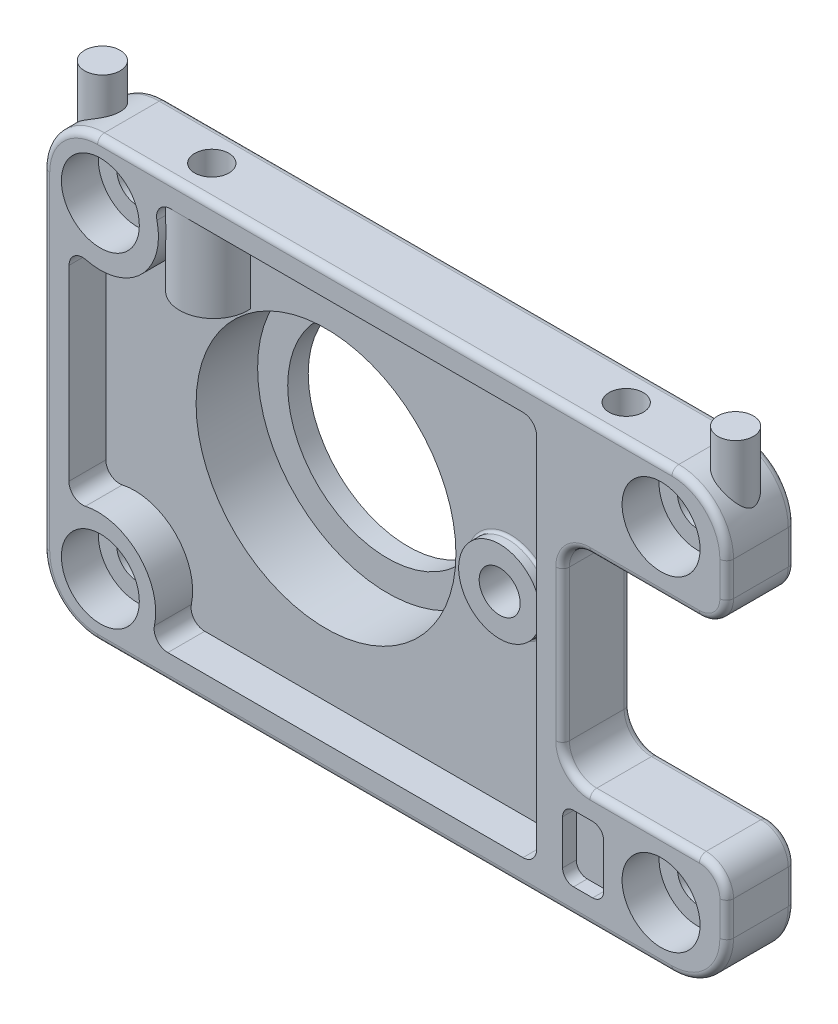
from build123d import *
from build123d.topology import SkipClean

# Parameters (mm, degrees)
SKETCH_1_R             = 1.5
SKETCH_1_R_2           = 9.5
EXTRUDE_1_DEPTH        = 5
CUT_EXTRUDE_START      = -2.7
SKETCH_2_R             = 9.5
SKETCH_2_R_2           = 2.85
SKETCH_2_R_3           = 1.5
CUT_EXTRUDE_1_DEPTH    = 2.7
FILLET_1_R             = 1
FILLET_2_R             = 4
FILLET_3_R             = 2
EXTRUDE_START          = 2.2
SKETCH_3_R             = 11.75
SKETCH_3_R_2           = 9.5
EXTRUDE_2_DEPTH        = 2.2
EXTRUDE_START_2        = 1.5
SKETCH_4_R             = 11.75
SKETCH_4_R_2           = 7.3
EXTRUDE_3_DEPTH        = 1.5
FILLET_4_R             = 0.5
FILLET_5_R             = 0.5
EXTRUDE_7_DEPTH        = 8
HOLE_WIZARD_M3_3_D     = 2.5
HOLE_WIZARD_M3_3_DEPTH = 5.5
HOLE_WIZARD_M3_3_TIP   = 0.751075774
FILLET_6_R             = 0.5
EXTRUDE_8_REACH        = 62.953
EXTRUDE_8_END_RADIUS   = 4
SKETCH_14_R            = 1.3
SKETCH_15_3_W          = 3
SKETCH_15_3_H          = 4.84
CUT_EXTRUDE_5_DEPTH    = 1
FILLET_9_R             = 0.8
SKETCH_16_R            = 3
SKETCH_16_R_2          = 1.5
EXTRUDE_9_DEPTH        = 0.8
EXTRUDE_START_3        = -4
SKETCH_16_2_R          = 3
EXTRUDE_10_DEPTH       = 4
CUT_EXTRUDE_START_2    = -3.6
CUT_EXTRUDE_3_DEPTH    = 3.6
FILLET_8_R             = 0.2
SKETCH_17_R            = 2.85
SKETCH_17_R_2          = 1.5
CUT_EXTRUDE_4_DEPTH    = 1


with BuildPart() as part:
    # 草图1 → 凸台-拉伸1 (new body)
    with BuildSketch(Plane.XY):
        Polygon((0, 0), (50, 0), (50, 8.5), (38, 8.5), (38, 23.5), (50, 23.5), (50, 32), (0, 32), align=None)
        with Locations((4.2, 27.9)):
            Circle(SKETCH_1_R, mode=Mode.SUBTRACT)
        with Locations((45.2, 27.9)):
            Circle(SKETCH_1_R, mode=Mode.SUBTRACT)
        with Locations((45.2, 4.1)):
            Circle(SKETCH_1_R, mode=Mode.SUBTRACT)
        with Locations((4.2, 4.1)):
            Circle(SKETCH_1_R, mode=Mode.SUBTRACT)
        with Locations((18, 16)):
            Circle(SKETCH_1_R_2, mode=Mode.SUBTRACT)
    extrude(amount=EXTRUDE_1_DEPTH)

    # 草图2 → 切除-拉伸1 (cut)
    # profile 1 of 6: a face of its own
    with BuildSketch(Plane.XY.offset(5).offset(CUT_EXTRUDE_START)):
        with BuildLine():
            ThreePointArc((7.694928957, 1.9), (7.00520382, 7.00520382), (1.9, 7.694928957))
            Line((1.9, 7.694928957), (1.912438276, 24.318162293))
            ThreePointArc((1.912438276, 24.318162293), (7.168529783, 24.858564332), (7.836275567, 30.1))
            Line((7.836275567, 30.1), (36.1, 30.1))
            Line((36.1, 30.1), (36.1, 1.9))
            Line((36.1, 1.9), (7.694928957, 1.9))
        make_face()
        with Locations((18, 16)):
            Circle(SKETCH_2_R, mode=Mode.SUBTRACT)
    # profile 2 of 6: a face of its own
    with BuildSketch(Plane.XY.offset(5).offset(CUT_EXTRUDE_START)):
        with Locations((18, 16)):
            Circle(SKETCH_2_R)
    # profile 3 of 6: a face of its own
    with BuildSketch(Plane.XY.offset(5).offset(CUT_EXTRUDE_START)):
        with Locations((45.2, 27.9)):
            Circle(SKETCH_2_R_2)
        with Locations((45.2, 27.9)):
            Circle(SKETCH_2_R_3, mode=Mode.SUBTRACT)
    # profile 4 of 6: a face of its own
    with BuildSketch(Plane.XY.offset(5).offset(CUT_EXTRUDE_START)):
        with Locations((45.2, 4.1)):
            Circle(SKETCH_2_R_2)
        with Locations((45.2, 4.1)):
            Circle(SKETCH_2_R_3, mode=Mode.SUBTRACT)
    # profile 5 of 6: a face of its own
    with BuildSketch(Plane.XY.offset(5).offset(CUT_EXTRUDE_START)):
        with Locations((4.2, 27.9)):
            Circle(SKETCH_2_R_2)
        with Locations((4.2, 27.9)):
            Circle(SKETCH_2_R_3, mode=Mode.SUBTRACT)
    # profile 6 of 6: a face of its own
    with BuildSketch(Plane.XY.offset(5).offset(CUT_EXTRUDE_START)):
        with Locations((4.2, 4.1)):
            Circle(SKETCH_2_R_2)
        with Locations((4.2, 4.1)):
            Circle(SKETCH_2_R_3, mode=Mode.SUBTRACT)
    extrude(amount=CUT_EXTRUDE_1_DEPTH, mode=Mode.SUBTRACT)

    # 圆角1
    fillet_1_edges = [part.edges().sort_by_distance(p)[0] for p in [
        (7.694928957, 1.9, 3.65),
        (1.9, 7.694928957, 3.65),
        (1.912438276, 24.318162293, 3.65),
        (7.836275567, 30.1, 3.65),
        (36.1, 30.1, 3.65),
        (36.1, 1.9, 3.65),
    ]]
    fillet(fillet_1_edges, radius=FILLET_1_R)

    # 圆角2
    fillet_2_edges = [part.edges().sort_by_distance(p)[0] for p in [
        (0, 32, 2.5),
        (50, 32, 2.5),
        (50, 0, 2.5),
        (0, 0, 2.5),
    ]]
    fillet(fillet_2_edges, radius=FILLET_2_R)

    # 圆角3
    fillet_3_edges = [part.edges().sort_by_distance(p)[0] for p in [
        (50, 23.5, 2.5),
        (38, 23.5, 2.5),
        (38, 8.5, 2.5),
        (50, 8.5, 2.5),
    ]]
    fillet(fillet_3_edges, radius=FILLET_3_R)

    # 草图3 → 凸台-拉伸2 (add)
    with SkipClean():  # the faces are left unmerged after this step: merging them gives an invalid solid
        with BuildSketch(Plane(origin=(0, 0, 0), x_dir=(-1, 0, 0), z_dir=(0, 0, -1)).offset(EXTRUDE_START)):
            with Locations((-18, 16)):
                Circle(SKETCH_3_R)
            with Locations((-18, 16)):
                Circle(SKETCH_3_R_2, mode=Mode.SUBTRACT)
        extrude(amount=-EXTRUDE_2_DEPTH)

    # 草图4 → 凸台-拉伸3 (add)
    with SkipClean():  # the faces are left unmerged after this step: merging them gives an invalid solid
        with BuildSketch(Plane(origin=(0, 0, -2.2), x_dir=(-1, 0, 0), z_dir=(0, 0, -1)).offset(EXTRUDE_START_2)):
            with Locations((-18, 16)):
                Circle(SKETCH_4_R)
            with Locations((-18, 16)):
                Circle(SKETCH_4_R_2, mode=Mode.SUBTRACT)
        extrude(amount=-EXTRUDE_3_DEPTH)

    # 圆角4
    fillet_4_edges = [part.edges().sort_by_distance(p)[0] for p in [
        (29.75, 16, -3.7),
    ]]
    fillet(fillet_4_edges, radius=FILLET_4_R)

    # 圆角5
    fillet_5_edges = [part.edges().sort_by_distance(p)[0] for p in [
        (25, 0, 0),
        (0, 16, 0),
        (25, 32, 0),
        (50, 5.25, 0),
        (48.828427125, 30.828427125, 0),
        (48.828427125, 1.171572875, 0),
        (1.171572875, 30.828427125, 0),
        (1.171572875, 1.171572875, 0),
        (44, 23.5, 0),
        (38, 16, 0),
        (44, 8.5, 0),
        (50, 26.75, 0),
        (49.414213562, 24.085786438, 0),
        (49.414213562, 7.914213562, 0),
        (38.585786438, 22.914213562, 0),
        (38.585786438, 9.085786438, 0),
    ]]
    fillet(fillet_5_edges, radius=FILLET_5_R)

    # 草图11 → 凸台-拉伸7 (add)
    with BuildSketch(Plane(origin=(0, 32, 0), x_dir=(1, 0, 0), z_dir=(0, 1, 0))):
        with BuildLine():
            Line((12.491987159, -2.3), (7.508012841, -2.3))
            ThreePointArc((7.508012841, -2.3), (10, -5), (12.491987159, -2.3))
        make_face()
    extrude(amount=-EXTRUDE_7_DEPTH)

    # M3 螺纹孔3
    with Locations(Plane(origin=(0, 32, 0), x_dir=(1, 0, 0), z_dir=(0, 1, 0))):
        with Locations((9.85, -2.5), (40.15, -2.5)):
            Hole(HOLE_WIZARD_M3_3_D / 2, depth=HOLE_WIZARD_M3_3_DEPTH)
            with Locations((0, 0, -(HOLE_WIZARD_M3_3_DEPTH + HOLE_WIZARD_M3_3_TIP / 2))):  # 118° drill point
                Cone(0, HOLE_WIZARD_M3_3_D / 2, HOLE_WIZARD_M3_3_TIP, mode=Mode.SUBTRACT)

    # 圆角6
    # the kernel refuses this fillet: 0.5 mm, written as the material it takes off along each edge
    with BuildSketch(Plane(origin=(4, 0, 5), x_dir=(0, 0, -1), z_dir=(1, 0, 0))) as fillet_6_piece_1:
        with BuildLine():
            CenterArc((FILLET_6_R, FILLET_6_R), FILLET_6_R, 180, 90)
            Line((0, FILLET_6_R), (0, 0))
            Line((0, 0), (FILLET_6_R, 0))
        make_face()
    extrude(amount=42, mode=Mode.SUBTRACT)
    with BuildSketch(Plane(origin=(0, 28, 5), x_dir=(0, 0, -1), z_dir=(0, -1, 0))) as fillet_6_piece_2:
        with BuildLine():
            CenterArc((FILLET_6_R, FILLET_6_R), FILLET_6_R, 180, 90)
            Line((0, FILLET_6_R), (0, 0))
            Line((0, 0), (FILLET_6_R, 0))
        make_face()
    extrude(amount=24, mode=Mode.SUBTRACT)
    with BuildSketch(Plane(origin=(50, 4, 5), x_dir=(0, 0, -1), z_dir=(0, 1, 0)), Plane(origin=(50, 25.5, 5), x_dir=(0, 0, -1), z_dir=(0, 1, 0))) as fillet_6_piece_3:
        with BuildLine():
            CenterArc((FILLET_6_R, FILLET_6_R), FILLET_6_R, 180, 90)
            Line((0, FILLET_6_R), (0, 0))
            Line((0, 0), (FILLET_6_R, 0))
        make_face()
    extrude(amount=2.5, mode=Mode.SUBTRACT)
    with BuildSketch(Plane(origin=(46, 32, 5), x_dir=(0, 0, -1), z_dir=(-1, 0, 0))) as fillet_6_piece_4:
        with BuildLine():
            CenterArc((FILLET_6_R, FILLET_6_R), FILLET_6_R, 180, 90)
            Line((0, FILLET_6_R), (0, 0))
            Line((0, 0), (FILLET_6_R, 0))
        make_face()
    extrude(amount=36.000000034, mode=Mode.SUBTRACT)
    with BuildSketch(Plane(origin=(46, 28, 5), x_dir=(0, 1, 0), z_dir=(-1, 0, 0))) as fillet_6_piece_5:
        with BuildLine():
            CenterArc((4 - FILLET_6_R, FILLET_6_R), FILLET_6_R, 270, 90)
            Line((4 - FILLET_6_R, 0), (4, 0))
            Line((4, 0), (4, FILLET_6_R))
        make_face()
    revolve(axis=Axis((46, 28, 5), (0, 0, -1)), revolution_arc=90, mode=Mode.SUBTRACT)
    with BuildSketch(Plane(origin=(46, 4, 5), x_dir=(0, -1, 0), z_dir=(-1, 0, 0))) as fillet_6_piece_6:
        with BuildLine():
            CenterArc((4 - FILLET_6_R, -FILLET_6_R), FILLET_6_R, 0, 90)
            Line((4 - FILLET_6_R, 0), (4, 0))
            Line((4, 0), (4, -FILLET_6_R))
        make_face()
    revolve(axis=Axis((46, 4, 5), (0, 0, 1)), revolution_arc=90, mode=Mode.SUBTRACT)
    with BuildSketch(Plane(origin=(4, 28, 5), x_dir=(-1, 0, 0), z_dir=(0, -1, 0))) as fillet_6_piece_7:
        with BuildLine():
            CenterArc((4 - FILLET_6_R, FILLET_6_R), FILLET_6_R, 270, 90)
            Line((4 - FILLET_6_R, 0), (4, 0))
            Line((4, 0), (4, FILLET_6_R))
        make_face()
    revolve(axis=Axis((4, 28, 5), (0, 0, -1)), revolution_arc=90, mode=Mode.SUBTRACT)
    with BuildSketch(Plane(origin=(4, 4, 5), x_dir=(0, -1, 0), z_dir=(1, 0, 0))) as fillet_6_piece_8:
        with BuildLine():
            CenterArc((4 - FILLET_6_R, FILLET_6_R), FILLET_6_R, 270, 90)
            Line((4 - FILLET_6_R, 0), (4, 0))
            Line((4, 0), (4, FILLET_6_R))
        make_face()
    revolve(axis=Axis((4, 4, 5), (0, 0, -1)), revolution_arc=90, mode=Mode.SUBTRACT)
    with BuildSketch(Plane(origin=(40, 23.5, 5), x_dir=(0, 0, -1), z_dir=(1, 0, 0)), Plane(origin=(48, 8.5, 5), x_dir=(0, 0, -1), z_dir=(-1, 0, 0))) as fillet_6_piece_9:
        with BuildLine():
            CenterArc((FILLET_6_R, FILLET_6_R), FILLET_6_R, 180, 90)
            Line((0, FILLET_6_R), (0, 0))
            Line((0, 0), (FILLET_6_R, 0))
        make_face()
    extrude(amount=8, mode=Mode.SUBTRACT)
    with BuildSketch(Plane(origin=(38, 10.5, 5), x_dir=(0, 0, -1), z_dir=(0, 1, 0))) as fillet_6_piece_10:
        with BuildLine():
            CenterArc((FILLET_6_R, FILLET_6_R), FILLET_6_R, 180, 90)
            Line((0, FILLET_6_R), (0, 0))
            Line((0, 0), (FILLET_6_R, 0))
        make_face()
    extrude(amount=11, mode=Mode.SUBTRACT)
    with BuildSketch(Plane(origin=(48, 25.5, 5), x_dir=(0, -1, 0), z_dir=(-1, 0, 0))) as fillet_6_piece_11:
        with BuildLine():
            CenterArc((2 - FILLET_6_R, -FILLET_6_R), FILLET_6_R, 0, 90)
            Line((2 - FILLET_6_R, 0), (2, 0))
            Line((2, 0), (2, -FILLET_6_R))
        make_face()
    revolve(axis=Axis((48, 25.5, 5), (0, 0, 1)), revolution_arc=90, mode=Mode.SUBTRACT)
    with BuildSketch(Plane(origin=(48, 6.5, 5), x_dir=(1, 0, 0), z_dir=(0, -1, 0))) as fillet_6_piece_12:
        with BuildLine():
            CenterArc((2 - FILLET_6_R, -FILLET_6_R), FILLET_6_R, 0, 90)
            Line((2 - FILLET_6_R, 0), (2, 0))
            Line((2, 0), (2, -FILLET_6_R))
        make_face()
    revolve(axis=Axis((48, 6.5, 5), (0, 0, 1)), revolution_arc=90, mode=Mode.SUBTRACT)
    with BuildSketch(Plane(origin=(40, 21.5, 5), x_dir=(-1, 0, 0), z_dir=(0, -1, 0))) as fillet_6_piece_13:
        with BuildLine():
            CenterArc((2 + FILLET_6_R, FILLET_6_R), FILLET_6_R, 180, 90)
            Line((2 + FILLET_6_R, 0), (2, 0))
            Line((2, 0), (2, FILLET_6_R))
        make_face()
    revolve(axis=Axis((40, 21.5, 5), (0, 0, -1)), revolution_arc=90, mode=Mode.SUBTRACT)
    with BuildSketch(Plane(origin=(40, 10.5, 5), x_dir=(0, -1, 0), z_dir=(1, 0, 0))) as fillet_6_piece_14:
        with BuildLine():
            CenterArc((2 + FILLET_6_R, FILLET_6_R), FILLET_6_R, 180, 90)
            Line((2 + FILLET_6_R, 0), (2, 0))
            Line((2, 0), (2, FILLET_6_R))
        make_face()
    revolve(axis=Axis((40, 10.5, 5), (0, 0, -1)), revolution_arc=90, mode=Mode.SUBTRACT)
    with BuildSketch(Plane(origin=(9.999999966, 32, 5), x_dir=(0, 0, -1), z_dir=(-1, 0, 0))) as fillet_6_piece_15:
        with BuildLine():
            CenterArc((FILLET_6_R, FILLET_6_R), FILLET_6_R, 180, 90)
            Line((0, FILLET_6_R), (0, 0))
            Line((0, 0), (FILLET_6_R, 0))
        make_face()
    extrude(amount=5.999999966, mode=Mode.SUBTRACT)

    # 凸台-拉伸8: up to this cylinder (the profile starts outside it)
    extrude_8_end = Plane(origin=(4, 28, 2.5), z_dir=(0, 0, -1)) * Cylinder(EXTRUDE_8_END_RADIUS, 134.906, mode=Mode.PRIVATE)
    # 草图14 → 凸台-拉伸8 (add, up to the surface)
    with BuildSketch(Plane(origin=(0, 34.5, 0), x_dir=(1, 0, 0), z_dir=(0, 1, 0)), mode=Mode.PRIVATE) as extrude_8_sk1:
        with Locations(Location((1.85, -2.5, 0), (0, 0, 270))):
            Circle(SKETCH_14_R)
    extrude_8_tool1 = extrude(extrude_8_sk1.sketch, amount=-EXTRUDE_8_REACH, mode=Mode.PRIVATE) - extrude_8_end
    extrude_8 = extrude_8_tool1.solids().sort_by_distance((1.85, 34.5, 2.5))[0]
    add(extrude_8)

    # 镜向7: 凸台-拉伸8 across plane
    add(extrude_8.mirror(Plane(origin=(25, 0, 0), x_dir=(0, 0, 1), z_dir=(1, 0, 0))))

    # 草图15<3> → 切除-拉伸5 (cut)
    with BuildSketch(Plane.XY.offset(5)):
        with Locations((39.5, 4.32)):
            Rectangle(SKETCH_15_3_W, SKETCH_15_3_H)
    extrude(amount=-CUT_EXTRUDE_5_DEPTH, mode=Mode.SUBTRACT)

    # 圆角9
    fillet_9_edges = [part.edges().sort_by_distance(p)[0] for p in [
        (41, 1.9, 4.5),
        (38, 1.9, 4.5),
        (38, 6.74, 4.5),
        (41, 6.74, 4.5),
    ]]
    fillet(fillet_9_edges, radius=FILLET_9_R)

    # 草图16 → 凸台-拉伸9 (add)
    with BuildSketch(Plane.XY.offset(2.3)):
        with Locations((31.5, 16)):
            Circle(SKETCH_16_R)
        with Locations((31.5, 16)):
            Circle(SKETCH_16_R_2, mode=Mode.SUBTRACT)
    extrude(amount=EXTRUDE_9_DEPTH)

    # 草图16<2> → 凸台-拉伸10 (add)
    with BuildSketch(Plane.XY.offset(2.3).offset(EXTRUDE_START_3)):
        with Locations((31.5, 16)):
            Circle(SKETCH_16_2_R)
    extrude(amount=EXTRUDE_10_DEPTH)

    # 草图16<3> → 切除-拉伸3 (cut)
    with BuildSketch(Plane.XY.offset(2.3).offset(CUT_EXTRUDE_START_2)):
        with BuildLine():
            ThreePointArc((30, 16), (31.5, 14.5), (33, 16))
            Line((33, 16), (30, 16))
        make_face()
        with BuildLine():
            Line((30, 16), (33, 16))
            ThreePointArc((33, 16), (31.5, 17.5), (30, 16))
        make_face()
    extrude(amount=CUT_EXTRUDE_3_DEPTH, mode=Mode.SUBTRACT)

    # 圆角8
    fillet_8_edges = [part.edges().sort_by_distance(p)[0] for p in [
        (28.5, 16, 2.3),
        (32.743036158, 13.269640846, -1.7),
    ]]
    fillet(fillet_8_edges, radius=FILLET_8_R)

    # 草图17 → 切除-拉伸4 (cut)
    # profile 1 of 4: a face of its own
    with BuildSketch(Plane(origin=(0, 0, 0), x_dir=(-1, 0, 0), z_dir=(0, 0, -1))):
        with Locations(Location((-45.2, 27.9, 0), (0, 0, 180))):
            Circle(SKETCH_17_R)
        with Locations((-45.2, 27.9)):
            Circle(SKETCH_17_R_2, mode=Mode.SUBTRACT)
    # profile 2 of 4: a face of its own
    with BuildSketch(Plane(origin=(0, 0, 0), x_dir=(-1, 0, 0), z_dir=(0, 0, -1))):
        with Locations(Location((-4.2, 27.9, 0), (0, 0, 180))):
            Circle(SKETCH_17_R)
        with Locations((-4.2, 27.9)):
            Circle(SKETCH_17_R_2, mode=Mode.SUBTRACT)
    # profile 3 of 4: a face of its own
    with BuildSketch(Plane(origin=(0, 0, 0), x_dir=(-1, 0, 0), z_dir=(0, 0, -1))):
        with Locations(Location((-45.2, 4.1, 0), (0, 0, 180))):
            Circle(SKETCH_17_R)
        with Locations((-45.2, 4.1)):
            Circle(SKETCH_17_R_2, mode=Mode.SUBTRACT)
    # profile 4 of 4: a face of its own
    with BuildSketch(Plane(origin=(0, 0, 0), x_dir=(-1, 0, 0), z_dir=(0, 0, -1))):
        with Locations(Location((-4.2, 4.1, 0), (0, 0, 180))):
            Circle(SKETCH_17_R)
        with Locations((-4.2, 4.1)):
            Circle(SKETCH_17_R_2, mode=Mode.SUBTRACT)
    extrude(amount=-CUT_EXTRUDE_4_DEPTH, mode=Mode.SUBTRACT)


solid = part.part
